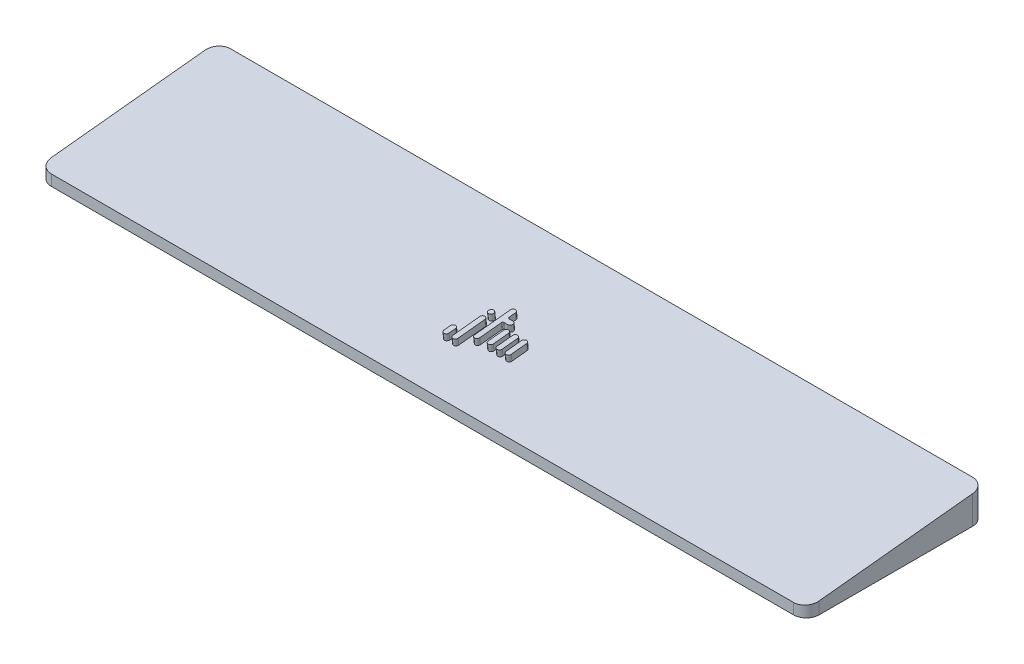
from build123d import *

# Parameters (mm, degrees)
BOSS_EXTRUDE1_REACH = 318.657
SKETCH1_W           = 300
SKETCH1_H           = 70
SKETCH2_R           = 1
BOSS_EXTRUDE2_DEPTH = 2.5
FILLET1_R           = 5
FILLET2_R           = 0.5


with BuildPart() as part:
    # Boss-Extrude1: up to this plane
    boss_extrude1_end = Plane(origin=(0, 4.176991961, 0.439019546), z_dir=(0, 0.9945218953682733, 0.10452846326765369))
    # Sketch1 → Boss-Extrude1 (new, up to the surface)
    with BuildSketch(Plane(origin=(0, 0, 0), x_dir=(1, 0, 0), z_dir=(0, 1, 0)), mode=Mode.PRIVATE) as boss_extrude1_sk1:
        with Locations((150, 35)):
            Rectangle(SKETCH1_W, SKETCH1_H)
    boss_extrude1_tool1 = split(extrude(boss_extrude1_sk1.sketch, amount=BOSS_EXTRUDE1_REACH, mode=Mode.PRIVATE), bisect_by=boss_extrude1_end, keep=Keep.BOTH, mode=Mode.PRIVATE)
    add(boss_extrude1_tool1.solids().sort_by_distance((150, 0, -35))[0])

    # Sketch2 → Boss-Extrude2 (add)
    with BuildSketch(Plane(origin=(0, 4.176991961, 0.439019546), x_dir=(-1, 0, 0), z_dir=(0, 0.9945218953682733, 0.10452846326765368))):
        with BuildLine():
            ThreePointArc((-149.1, -38.141437788), (-148.1, -39.141437788), (-147.1, -38.141437788))
            Line((-147.1, -38.141437788), (-147.1, -24.141437788))
            ThreePointArc((-147.1, -24.141437788), (-148.1, -23.141437788), (-149.1, -24.141437788))
            Line((-149.1, -24.141437788), (-149.1, -33.141437788))
            Line((-149.1, -33.141437788), (-151.1, -33.141437788))
            ThreePointArc((-151.1, -33.141437788), (-152.1, -34.141437788), (-151.1, -35.141437788))
            Line((-151.1, -35.141437788), (-149.1, -35.141437788))
            Line((-149.1, -35.141437788), (-149.1, -38.141437788))
        make_face()
        with BuildLine():
            ThreePointArc((-144.6, -30.641437788), (-143.6, -31.641437788), (-142.6, -30.641437788))
            Line((-142.6, -30.641437788), (-142.6, -20.141437788))
            ThreePointArc((-142.6, -20.141437788), (-143.6, -19.141437788), (-144.6, -20.141437788))
            Line((-144.6, -20.141437788), (-144.6, -30.641437788))
        make_face()
        with BuildLine():
            ThreePointArc((-153.9, -30.641437788), (-152.9, -31.641437788), (-151.9, -30.641437788))
            Line((-151.9, -30.641437788), (-151.9, -24.641437788))
            ThreePointArc((-151.9, -24.641437788), (-152.9, -23.641437788), (-153.9, -24.641437788))
            Line((-153.9, -24.641437788), (-153.9, -30.641437788))
        make_face()
        with BuildLine():
            ThreePointArc((-157.4, -30.641437788), (-156.4, -31.641437788), (-155.4, -30.641437788))
            Line((-155.4, -30.641437788), (-155.4, -24.641437788))
            ThreePointArc((-155.4, -24.641437788), (-156.4, -23.641437788), (-157.4, -24.641437788))
            Line((-157.4, -24.641437788), (-157.4, -30.641437788))
        make_face()
        with BuildLine():
            ThreePointArc((-160.9, -30.641437788), (-159.9, -31.641437788), (-158.9, -30.641437788))
            Line((-158.9, -30.641437788), (-158.9, -24.641437788))
            ThreePointArc((-158.9, -24.641437788), (-159.9, -23.641437788), (-160.9, -24.641437788))
            Line((-160.9, -24.641437788), (-160.9, -30.641437788))
        make_face()
        with BuildLine():
            ThreePointArc((-141.1, -22.641437788), (-140.1, -23.641437788), (-139.1, -22.641437788))
            Line((-139.1, -22.641437788), (-139.1, -20.141437788))
            ThreePointArc((-139.1, -20.141437788), (-140.1, -19.141437788), (-141.1, -20.141437788))
            Line((-141.1, -20.141437788), (-141.1, -22.641437788))
        make_face()
        with Locations((-143.6, -34.141437788)):
            Circle(SKETCH2_R)
    extrude(amount=BOSS_EXTRUDE2_DEPTH)

    # Fillet1
    fillet1_edges = [part.edges().sort_by_distance(p)[0] for p in [
        (300, 5.790215621, -70),
        (300, 2.111567387, 0),
        (0, 2.111567387, 0),
        (0, 5.790215621, -70),
    ]]
    fillet(fillet1_edges, radius=FILLET1_R)

    # Fillet2
    fillet2_edges = [part.edges().sort_by_distance(p)[0] for p in [
        (149.1, 9.093424819, -34.37924919),
        (149.1, 8.884367892, -32.390205399),
    ]]
    fillet(fillet2_edges, radius=FILLET2_R)


solid = part.part
